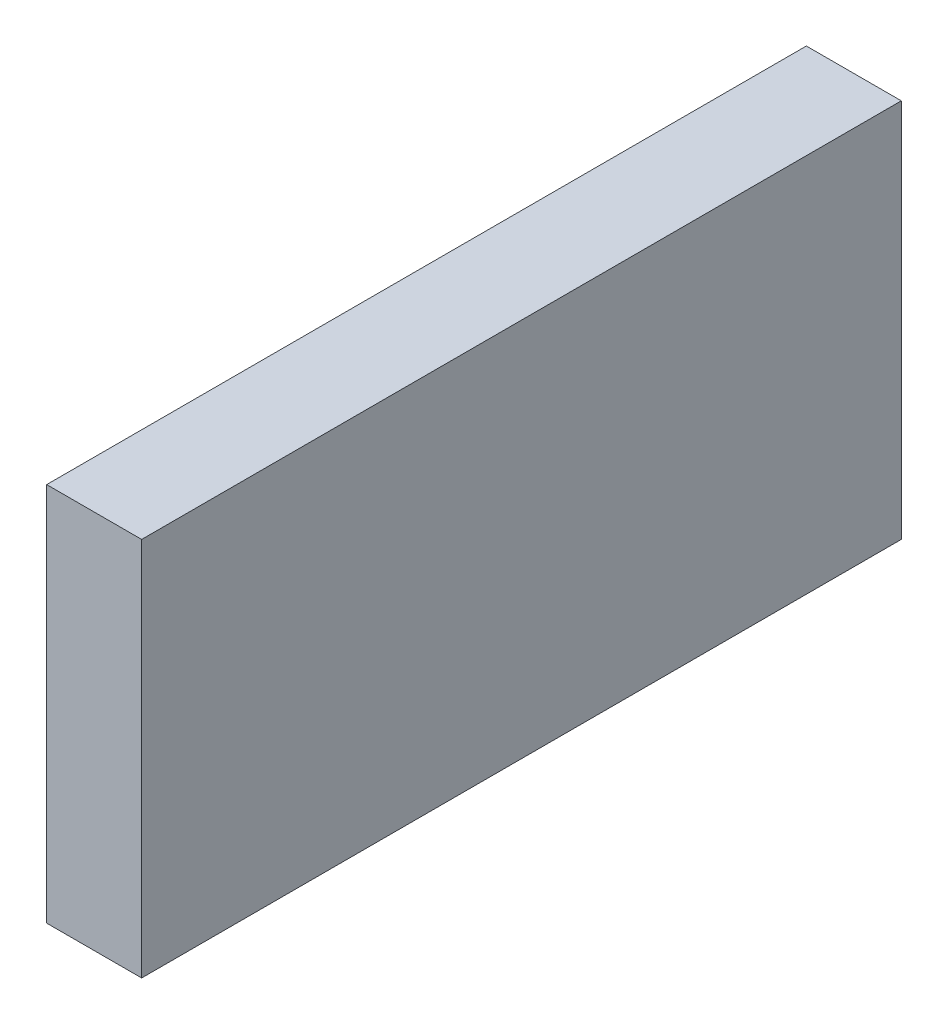
from build123d import *

# Parameters (mm, degrees)
SKETCH1_W      = 12.7
SKETCH1_H      = 50.8
EXTRUDE1_DEPTH = 50.8


with BuildPart() as part:
    # Sketch1 → Extrude1 (new, symmetric)
    with BuildSketch(Plane.XY):
        Rectangle(SKETCH1_W, SKETCH1_H)
    extrude(amount=EXTRUDE1_DEPTH, both=True)


solid = part.part
